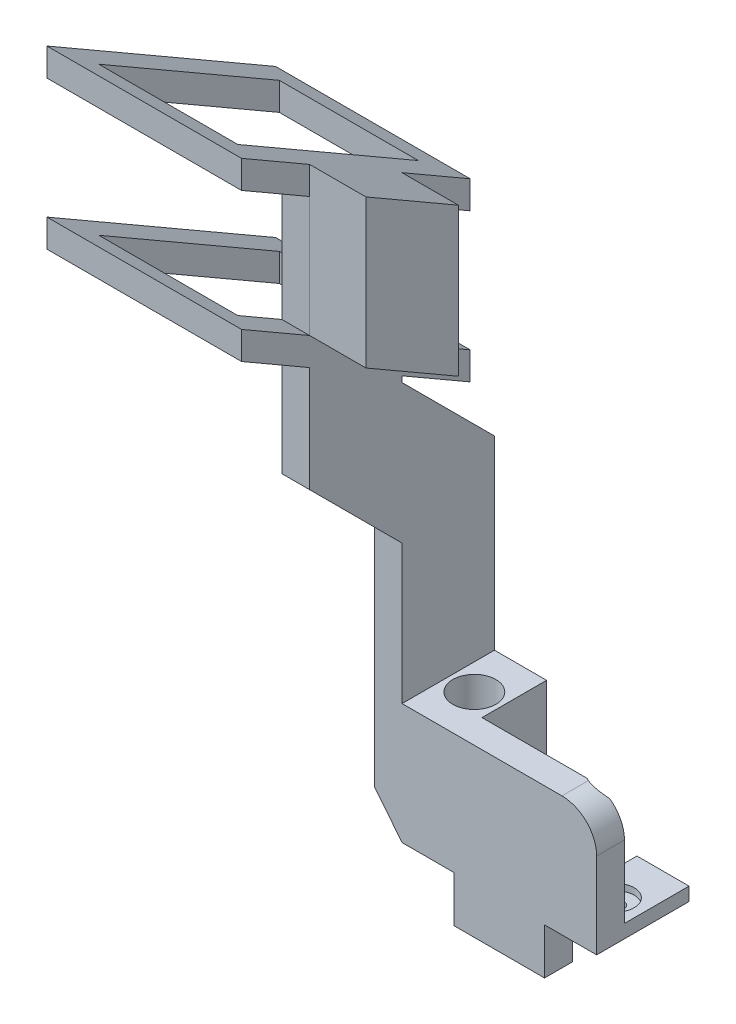
from build123d import *

# Parameters (mm, degrees)
SKETCH1_W             = 7.497163216
SKETCH1_H             = 13.3
SKETCH1_R             = 1
BOSS_EXTRUDE1_DEPTH   = 2
BOSS_EXTRUDE1_2_DEPTH = 2
SKETCH3_R             = 2.5
CUT_EXTRUDE1_DEPTH    = 1
BOSS_EXTRUDE3_DEPTH   = 1
SKETCH5_R             = 3.1
BOSS_EXTRUDE4_DEPTH   = 15.323280282
CUT_EXTRUDE2_REACH    = 37.51
SKETCH6_W             = 9.3
SKETCH6_H             = 13.397572085
BOSS_EXTRUDE5_START   = -13.397572085
BOSS_EXTRUDE5_DEPTH   = 13.397572085
SKETCH8_W             = 13.005673568
SKETCH8_H             = 3
BOSS_EXTRUDE6_DEPTH   = 10.5515
SKETCH9_W             = 13.3
SKETCH9_H             = 12.323280282
BOSS_EXTRUDE7_DEPTH   = 4
SKETCH10_W            = 4
SKETCH10_H            = 13.3
BOSS_EXTRUDE8_DEPTH   = 70
BOSS_EXTRUDE9_DEPTH   = 13.3
SKETCH15_W            = 4
SKETCH15_H            = 20
BOSS_EXTRUDE13_DEPTH  = 20
SKETCH16_W            = 4
SKETCH16_H            = 20
BOSS_EXTRUDE14_DEPTH  = 30
CUT_EXTRUDE3_DEPTH    = 20
BOSS_EXTRUDE15_DEPTH  = 4
BOSS_EXTRUDE16_DEPTH  = 20
SKETCH21_W            = 7.497163216
SKETCH21_H            = 9.3
CUT_EXTRUDE4_DEPTH    = 2
BOSS_EXTRUDE18_DEPTH  = 4
CUT_EXTRUDE5_DEPTH    = 4
BOSS_EXTRUDE20_DEPTH  = 8.1
FILLET1_R             = 5


with BuildPart() as part:
    # Sketch1 → Boss-Extrude1 (new body)
    with BuildSketch(Plane(origin=(0, 0, 0), x_dir=(1, 0, 0), z_dir=(0, 1, 0))):
        with Locations((6.360378056, -6.65)):
            Rectangle(SKETCH1_W, SKETCH1_H)
        with Locations(Location((6.360378056, -6.65, 0), (0, 0, 270))):
            Circle(SKETCH1_R, mode=Mode.SUBTRACT)
    extrude(amount=BOSS_EXTRUDE1_DEPTH)


with BuildPart() as body_2:
    # Sketch1 → Boss-Extrude1 2 (new body)
    with BuildSketch(Plane(origin=(0, 0, 0), x_dir=(1, 0, 0), z_dir=(0, 1, 0))):
        with Locations((26.86321484, -6.65)):
            Rectangle(SKETCH1_W, SKETCH1_H)
        with Locations(Location((26.86321484, -6.65, 0), (0, 0, 270))):
            Circle(SKETCH1_R, mode=Mode.SUBTRACT)
    extrude(amount=BOSS_EXTRUDE1_2_DEPTH)


with BuildPart() as cut_extrude1_tool:
    # Sketch3 → Cut-Extrude1 (new body)
    with BuildSketch(Plane(origin=(0, 2, 0), x_dir=(1, 0, 0), z_dir=(0, 1, 0))):
        with Locations(Location((26.86321484, -6.65, 0), (0, 0, 270))):
            Circle(SKETCH3_R)
        with Locations(Location((6.360378056, -6.65, 0), (0, 0, 270))):
            Circle(SKETCH3_R)
    extrude(amount=-CUT_EXTRUDE1_DEPTH)


with BuildPart() as part_1:
    add(part.part)

    # Cut-Extrude1: cut by cut_extrude1_tool
    add(cut_extrude1_tool.part, mode=Mode.SUBTRACT)



with BuildPart() as body_2_1:
    add(body_2.part)

    # Cut-Extrude1: cut by cut_extrude1_tool
    add(cut_extrude1_tool.part, mode=Mode.SUBTRACT)


with BuildPart() as part_2:
    add(part_1.part)

    add(body_2_1.part)  # Boss-Extrude3 merges body 2
    # Sketch4 → Boss-Extrude3 (add)
    with BuildSketch(Plane.XY.offset(13.3)):
        Polygon((10.108959664, 0), (10.108959664, -6.625791341), (23.114633232, -6.625791341), (23.114633232, 2), (10.108959664, 2), align=None)
    extrude(amount=-BOSS_EXTRUDE3_DEPTH)

    # Sketch5 → Boss-Extrude4 (add)
    with BuildSketch(Plane(origin=(0, 2, 0), x_dir=(1, 0, 0), z_dir=(0, 1, 0))):
        Polygon((10.108959664, 0), (2.611796448, 0), (2.611796448, -4), (2.611796448, -9.3), (2.611796448, -12.3), (2.611796448, -13.3), (30.611796448, -13.3), (30.611796448, -12.3), (30.611796448, -9.3), (30.611796448, -4), (30.611796448, 0), (23.114633232, 0), (23.114633232, -4), (23.114633232, -9.3), (23.114633232, -12.3), (10.108959664, -12.3), (10.108959664, -9.3), (10.108959664, -4), align=None)
        with Locations(Location((6.360378056, -6.65, 0), (0, 0, 270))):
            Circle(SKETCH5_R, mode=Mode.SUBTRACT)
        with Locations(Location((26.86321484, -6.65, 0), (0, 0, 270))):
            Circle(SKETCH5_R, mode=Mode.SUBTRACT)
    extrude(amount=BOSS_EXTRUDE4_DEPTH)

    # Cut-Extrude2: up to this face of the body (flat: up to its plane)
    cut_extrude2_end = Plane(part_2.part.faces().sort_by_distance((23.114633232, 8.661640141, 6.15))[0])
    # Sketch6 → Cut-Extrude2 (cut, up to the picked face)
    with BuildSketch(Plane(origin=(30.611796448, 0, 0), x_dir=(0, 0, -1), z_dir=(1, 0, 0)), mode=Mode.PRIVATE) as cut_extrude2_sk1:
        with Locations((-4.65, 10.62449424)):
            Rectangle(SKETCH6_W, SKETCH6_H)
    cut_extrude2_tool1 = split(extrude(cut_extrude2_sk1.sketch, amount=-CUT_EXTRUDE2_REACH, mode=Mode.PRIVATE), bisect_by=cut_extrude2_end, keep=Keep.BOTH, mode=Mode.PRIVATE)
    add(cut_extrude2_tool1.solids().sort_by(Axis((30.611796, 10.624494, 4.65), (-1, 0, 0)))[0], mode=Mode.SUBTRACT)

    # Sketch7 → Boss-Extrude5 (add)
    with BuildSketch(Plane(origin=(0, 17.323280282, 0), x_dir=(1, 0, 0), z_dir=(0, 1, 0)).offset(BOSS_EXTRUDE5_START)):
        with BuildLine():
            Line((28.471785634, -9.3), (30.611796448, -9.3))
            Line((30.611796448, -9.3), (30.611796448, -13.3))
            Line((30.611796448, -13.3), (10.108959664, -13.3))
            Line((10.108959664, -13.3), (10.108959664, -9.3))
            Line((10.108959664, -9.3), (25.254644046, -9.3))
            ThreePointArc((25.254644046, -9.3), (26.86321484, -9.75), (28.471785634, -9.3))
        make_face()
    extrude(amount=BOSS_EXTRUDE5_DEPTH)

    # Sketch8 → Boss-Extrude6 (add, through all)
    with BuildSketch(Plane.XZ.offset(-3.925708197)):
        with Locations((16.611796448, 10.8)):
            Rectangle(SKETCH8_W, SKETCH8_H)
    extrude(amount=BOSS_EXTRUDE6_DEPTH)

    # Sketch9 → Boss-Extrude7 (add)
    with BuildSketch(Plane.ZY.offset(-2.611796448)):
        with Locations((6.65, 11.161640141)):
            Rectangle(SKETCH9_W, SKETCH9_H)
    extrude(amount=BOSS_EXTRUDE7_DEPTH)

    # Sketch10 → Boss-Extrude8 (add)
    with BuildSketch(Plane(origin=(0, 17.323280282, 0), x_dir=(1, 0, 0), z_dir=(0, 1, 0))):
        with Locations((0.611796448, -6.65)):
            Rectangle(SKETCH10_W, SKETCH10_H)
    extrude(amount=BOSS_EXTRUDE8_DEPTH)

    # Sketch11 → Boss-Extrude9 (add)
    with BuildSketch(Plane.XY.offset(13.3)):
        Polygon((-1.388203552, 5), (2.611796448, 0), (2.611796448, 5), align=None)
    extrude(amount=-BOSS_EXTRUDE9_DEPTH)

    # Sketch15 → Boss-Extrude13 (add)
    with BuildSketch(Plane.XY.offset(13.3)):
        with Locations((0.611796448, 47.323280282)):
            Rectangle(SKETCH15_W, SKETCH15_H)
    extrude(amount=BOSS_EXTRUDE13_DEPTH)

    # Sketch16 → Boss-Extrude14 (add)
    with BuildSketch(Plane(origin=(0, 57.323280282, 0), x_dir=(1, 0, 0), z_dir=(0, 1, 0))):
        with Locations((0.611796448, -23.3)):
            Rectangle(SKETCH16_W, SKETCH16_H)
    extrude(amount=BOSS_EXTRUDE14_DEPTH)

    # Sketch17 → Cut-Extrude3 (cut)
    with BuildSketch(Plane.ZY.offset(1.388203552)):
        Polygon((13.3, 87.323280282), (0, 87.323280282), (0, 57.323280282), (0, 44.023280282), (13.3, 57.323280282), align=None)
        Polygon((33.3, 87.323280282), (26.6, 87.323280282), (26.6, 50.623280282), (13.3, 37.323280282), (26.6, 37.323280282), (33.3, 37.323280282), align=None)
    extrude(amount=-CUT_EXTRUDE3_DEPTH, mode=Mode.SUBTRACT)

    # Sketch18 → Boss-Extrude15 (add)
    with BuildSketch(Plane.ZY.offset(1.388203552)):
        Polygon((3.495517328, 77.823280282), (36.404482672, 96.823280282), (36.404482672, 92.823280282), (3.495517328, 73.823280282), align=None)
        Polygon((3.495517328, 56.502772207), (36.404482672, 75.502772207), (36.404482672, 71.502772207), (3.495517328, 52.502772207), align=None)
    extrude(amount=-BOSS_EXTRUDE15_DEPTH)

    # Sketch19 → Boss-Extrude16 (add)
    with BuildSketch(Plane.ZY.offset(1.388203552)):
        Polygon((3.495517328, 77.823280282), (6.959618943, 79.823280282), (6.959618943, 75.823280282), (3.495517328, 73.823280282), align=None)
        Polygon((3.495517328, 56.502772207), (6.959618943, 58.502772207), (6.959618943, 54.502772207), (3.495517328, 52.502772207), align=None)
        Polygon((36.404482672, 75.502772207), (32.940381057, 73.502772207), (32.940381057, 69.502772207), (36.404482672, 71.502772207), align=None)
        Polygon((36.404482672, 92.823280282), (32.940381057, 90.823280282), (32.940381057, 94.823280282), (36.404482672, 96.823280282), align=None)
    extrude(amount=BOSS_EXTRUDE16_DEPTH)

    # Sketch21 → Cut-Extrude4 (cut)
    with BuildSketch(Plane(origin=(0, 3.925708197, 0), x_dir=(1, 0, 0), z_dir=(0, 1, 0))):
        with Locations((26.86321484, -4.65)):
            Rectangle(SKETCH21_W, SKETCH21_H)
    extrude(amount=-CUT_EXTRUDE4_DEPTH, mode=Mode.SUBTRACT)

    # Sketch22 → Boss-Extrude18 (add)
    with BuildSketch(Plane.ZY.offset(21.388203552)):
        Polygon((3.495517328, 77.823280282), (36.404482672, 96.823280282), (36.404482672, 92.823280282), (3.495517328, 73.823280282), align=None)
        Polygon((3.495517328, 56.502772207), (3.495517328, 52.502772207), (36.404482672, 71.502772207), (36.404482672, 75.502772207), align=None)
    extrude(amount=BOSS_EXTRUDE18_DEPTH)

    # Sketch23 → Cut-Extrude5 (cut)
    with BuildSketch(Plane(origin=(2.611796448, 0, 0), x_dir=(0, 0, -1), z_dir=(1, 0, 0))):
        Polygon((-13.3, 87.323280282), (-13.3, 83.483900992), (-19.95, 87.323280282), align=None)
    extrude(amount=-CUT_EXTRUDE5_DEPTH, mode=Mode.SUBTRACT)

    # Sketch24 → Boss-Extrude20 (add)
    with BuildSketch(Plane(origin=(2.611796448, 0, 0), x_dir=(0, 0, -1), z_dir=(1, 0, 0))):
        Polygon((-26.6, 91.162659572), (-13.300321898, 83.48408684), (-13.3, 62.163392916), (-26.599678102, 69.841965649), align=None)
    extrude(amount=BOSS_EXTRUDE20_DEPTH)

    # Fillet1
    # the kernel refuses this fillet: 5 mm, written as the material it takes off along each edge
    with BuildSketch(Plane(origin=(30.611796448, 17.323280282, -3.2), x_dir=(-1, 0, 0), z_dir=(0, 0, 1))) as fillet1_piece_1:
        with BuildLine():
            CenterArc((FILLET1_R, FILLET1_R), FILLET1_R, 180, 90)
            Line((0, FILLET1_R), (0, 0))
            Line((0, 0), (FILLET1_R, 0))
        make_face()
    extrude(amount=29, mode=Mode.SUBTRACT)


solid = part_2.part
